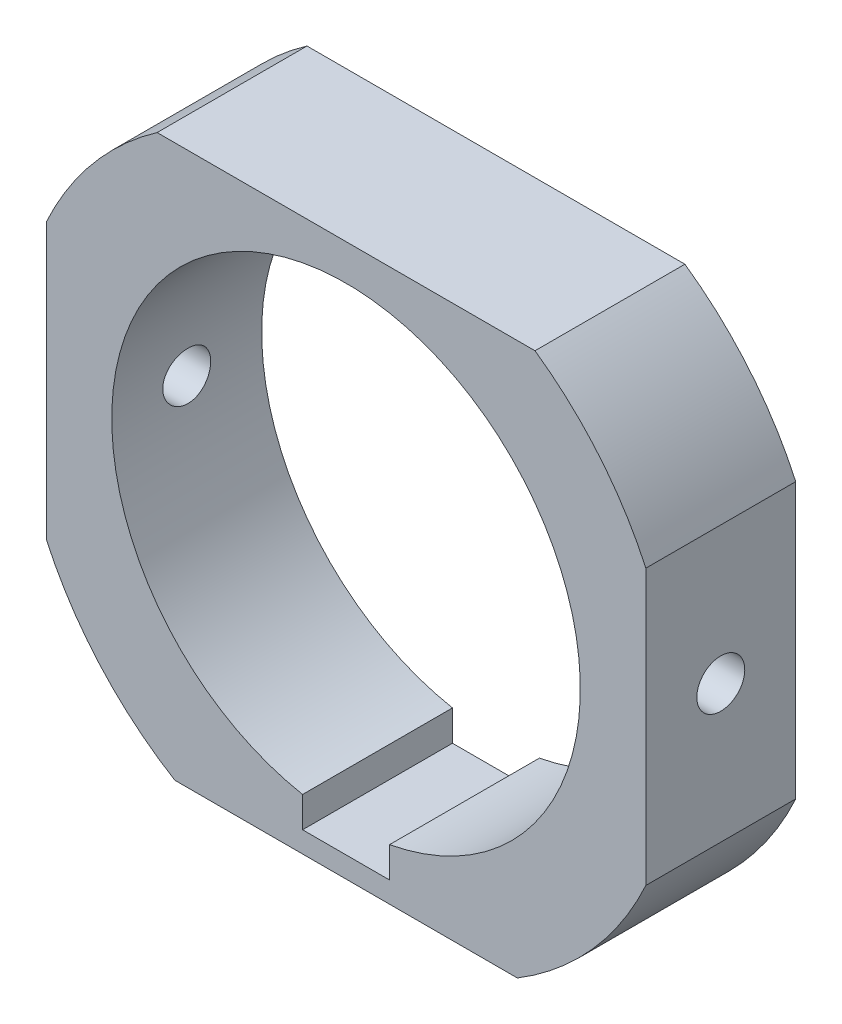
from build123d import *

# Parameters (mm, degrees)
BOSS_EXTRUDE1_DEPTH     = 5
CUT_EXTRUDE1_DEPTH      = 15.933519344
CUT_EXTRUDE1_DEPTH_BACK = 15.933519344
SKETCH2_W               = 5
SKETCH2_H               = 0.5
SKETCH3_R               = 0.8
CUT_EXTRUDE2_DEPTH      = 23.657449106


with BuildPart() as part:
    # Sketch1 → Boss-Extrude1 (new body)
    with BuildSketch(Plane.XY):
        with BuildLine():
            Line((6.303155956, 9.015), (-6.303155956, 9.015))
            ThreePointArc((-6.303155956, 9.015), (-8.447474169, 7.045578767), (-10, 4.582575695))
            Line((-10, 4.582575695), (-10, -4.582575695))
            ThreePointArc((-10, -4.582575695), (-7.860673921, -7.694790803), (-4.794788838, -9.9))
            Line((-4.794788838, -9.9), (4.794788838, -9.9))
            ThreePointArc((4.794788838, -9.9), (7.860673921, -7.694790803), (10, -4.582575695))
            Line((10, -4.582575695), (10, 4.582575695))
            ThreePointArc((10, 4.582575695), (8.447474169, 7.045578767), (6.303155956, 9.015))
        make_face()
        with BuildLine():
            Line((-1.45, -8.7), (-1.45, -7.679304982))
            ThreePointArc((-1.45, -7.679304982), (-4.987107127, 6.016891847), (7.815, 0))
            ThreePointArc((7.815, 0), (6.016891847, -4.987107127), (1.45, -7.679304982))
            Line((1.45, -7.679304982), (1.45, -8.7))
            Line((1.45, -8.7), (-1.45, -8.7))
        make_face(mode=Mode.SUBTRACT)
    extrude(amount=BOSS_EXTRUDE1_DEPTH)

    # Sketch2 → Cut-Extrude1 (cut, two sides: drawn at the far end of the back side and taken through both)
    with BuildSketch(Plane(origin=(0, 0, 0), x_dir=(0, 0, -1), z_dir=(1, 0, 0)).offset(-CUT_EXTRUDE1_DEPTH_BACK)):
        with Locations((-2.5, -9.65)):
            Rectangle(SKETCH2_W, SKETCH2_H)
    extrude(amount=CUT_EXTRUDE1_DEPTH + CUT_EXTRUDE1_DEPTH_BACK, mode=Mode.SUBTRACT)

    # Sketch3 → Cut-Extrude2 (cut, through all)
    with BuildSketch(Plane(origin=(10, 0, 0), x_dir=(0, 0, -1), z_dir=(1, 0, 0))):
        with Locations((-2.5, 0)):
            Circle(SKETCH3_R)
    extrude(amount=-CUT_EXTRUDE2_DEPTH, mode=Mode.SUBTRACT)


solid = part.part
